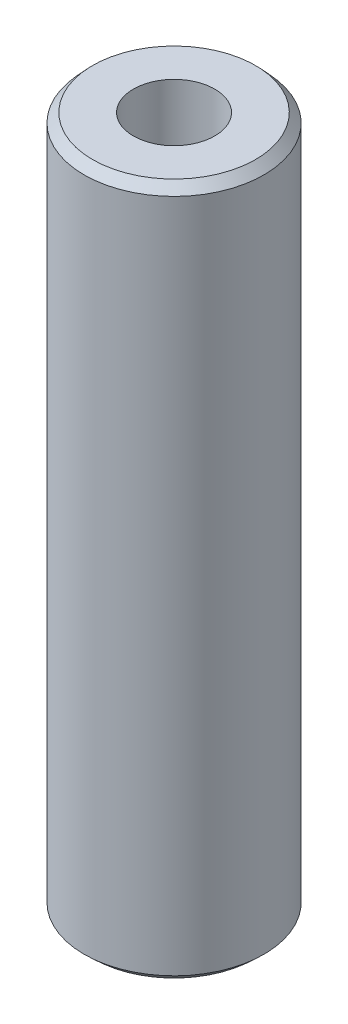
from build123d import *
from OCP.BRepFilletAPI import BRepFilletAPI_MakeChamfer

# Parameters (mm, degrees)
SKETCH1_R           = 42.5
BOSS_EXTRUDE1_DEPTH = 327.403839498
SKETCH2_R           = 19.227600723
CUT_EXTRUDE1_DEPTH  = 333.875012757
CHAMFER1_SIZE       = 4.300343813
CHAMFER1_SIZE2      = 3.968460728


with BuildPart() as part:
    # Sketch1 → Boss-Extrude1 (new body)
    with BuildSketch(Plane(origin=(0, 0, 0), x_dir=(1, 0, 0), z_dir=(0, 1, 0))):
        Circle(SKETCH1_R)
    extrude(amount=BOSS_EXTRUDE1_DEPTH)

    # Sketch2 → Cut-Extrude1 (cut, through all)
    with BuildSketch(Plane(origin=(0, 0, 0), x_dir=(1, 0, 0), z_dir=(0, 1, 0))):
        Circle(SKETCH2_R)
    extrude(amount=CUT_EXTRUDE1_DEPTH, mode=Mode.SUBTRACT)

    # Chamfer1: one chamfer whose edges measure the first distance from different faces: ONE call of the kernel's chamfer builder (chamfer() names one face for all edges)
    chamfer1_edges_1 = [part.edges().sort_by_distance(p)[0] for p in [
        (-42.5, 327.403839498, 0),
    ]]
    chamfer1_side_1 = [part.faces().sort_by_distance(p)[0] for p in [
        (-42.5, 163.701919749, 0),
    ]]
    chamfer1_edges_2 = [part.edges().sort_by_distance(p)[0] for p in [
        (-42.5, 0, 0),
    ]]
    chamfer1_side_2 = [part.faces().sort_by_distance(p)[0] for p in [
        (-41.297918472, 0, 0),
    ]]
    chamfer1 = BRepFilletAPI_MakeChamfer(part.part.solid().wrapped)
    for e in chamfer1_edges_1:
        chamfer1.Add(CHAMFER1_SIZE, CHAMFER1_SIZE2, e.wrapped, chamfer1_side_1[0].wrapped)  # the first distance lies on this face
    for e in chamfer1_edges_2:
        chamfer1.Add(CHAMFER1_SIZE, CHAMFER1_SIZE2, e.wrapped, chamfer1_side_2[0].wrapped)  # the first distance lies on this face
    add(Compound.cast(chamfer1.Shape()), mode=Mode.REPLACE)


solid = part.part
